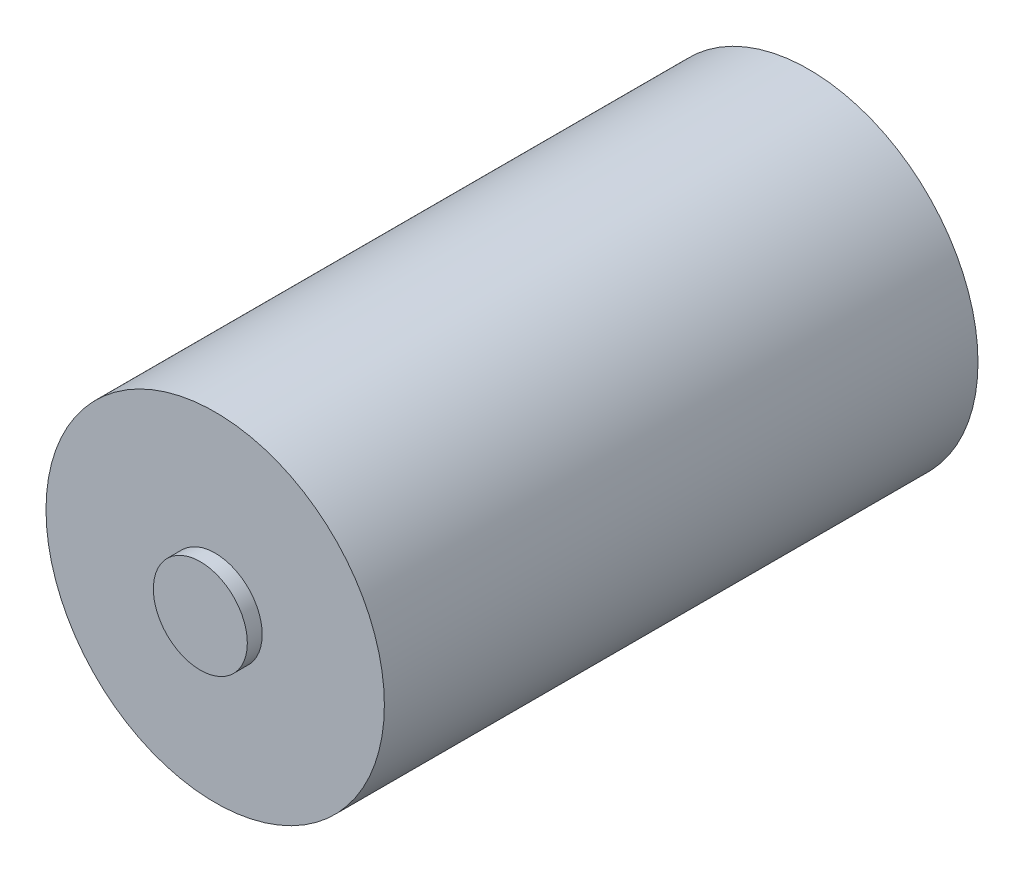
from build123d import *

# Parameters (mm, degrees)
ESQUISSE1_R             = 17.1
BOSS_EXTRU_1_DEPTH      = 61.5
ENL_V_START             = -1.5
ESQUISSE2_R             = 17.1
ESQUISSE2_R_2           = 4.75
ENL_V_MAT_EXTRU_1_DEPTH = 1.5


with BuildPart() as part:
    # Esquisse1 → Boss.-Extru.1 (new body)
    with BuildSketch(Plane.XY):
        Circle(ESQUISSE1_R)
    extrude(amount=BOSS_EXTRU_1_DEPTH)

    # Esquisse2 → Enlèv. mat.-Extru.1 (cut)
    with BuildSketch(Plane.XY.offset(61.5).offset(ENL_V_START)):
        Circle(ESQUISSE2_R)
        Circle(ESQUISSE2_R_2, mode=Mode.SUBTRACT)
    extrude(amount=ENL_V_MAT_EXTRU_1_DEPTH, mode=Mode.SUBTRACT)


solid = part.part
